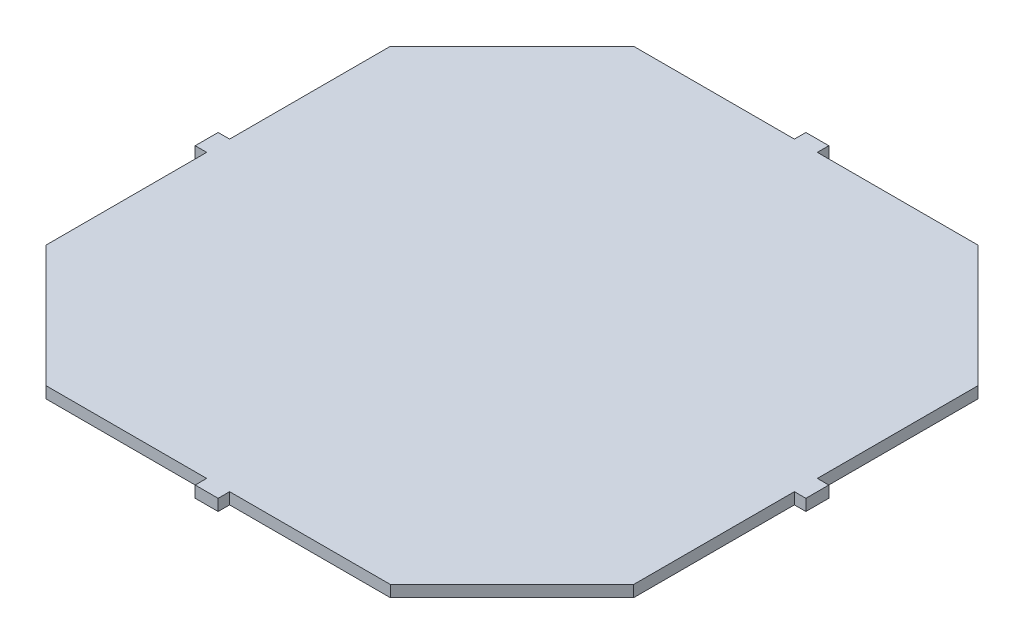
from build123d import *

# Parameters (mm, degrees)
BOSS_EXTRUDE1_DEPTH = 1
SKETCH2_W           = 1
SKETCH2_H           = 2
SKETCH2_W_2         = 2
SKETCH2_H_2         = 1
BOSS_EXTRUDE2_DEPTH = 1


with BuildPart() as part:
    # Sketch1 → Boss-Extrude1 (new body)
    with BuildSketch(Plane(origin=(0, 0, 0), x_dir=(1, 0, 0), z_dir=(0, 1, 0))):
        Polygon((-25.606601718, 15), (-15, 25.606601718), (15, 25.606601718), (25.606601718, 15), (25.606601718, -15), (15, -25.606601718), (-15, -25.606601718), (-25.606601718, -15), align=None)
    extrude(amount=BOSS_EXTRUDE1_DEPTH)

    # Sketch2 → Boss-Extrude2 (add)
    with BuildSketch(Plane(origin=(0, 1, 0), x_dir=(1, 0, 0), z_dir=(0, 1, 0))):
        with Locations((-26.106601718, 0)):
            Rectangle(SKETCH2_W, SKETCH2_H)
        with Locations((0, 26.106601718)):
            Rectangle(SKETCH2_W_2, SKETCH2_H_2)
        with Locations((0, -26.106601718)):
            Rectangle(SKETCH2_W_2, SKETCH2_H_2)
        with Locations((26.106601718, 0)):
            Rectangle(SKETCH2_W, SKETCH2_H)
    extrude(amount=-BOSS_EXTRUDE2_DEPTH)


solid = part.part
